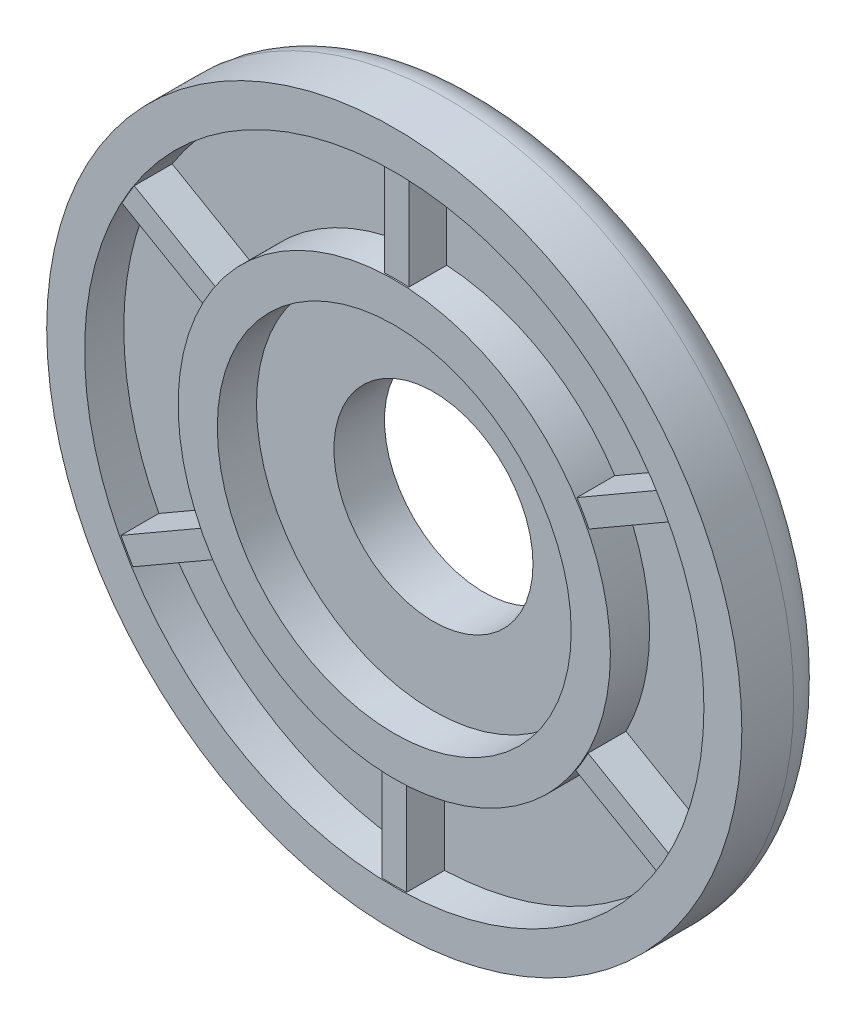
from build123d import *

# Parameters (mm, degrees)
SKETCH_1_R           = 27.5
SKETCH_1_R_2         = 7.875
EXTRUDE_1_DEPTH      = 4
EXTRUDE_2_DEPTH      = 3.1
EXTRUDE_2_DEPTH_BACK = 3.1
SKETCH_2_R           = 27.5
SKETCH_2_R_2         = 24.5
SKETCH_2_R_3         = 17.1
SKETCH_2_R_4         = 14
SKETCH_4_W           = 1.93
SKETCH_4_H           = 8.275236112
EXTRUDE_6_DEPTH      = 3
FILLET_1_R           = 3


with BuildPart() as part:
    # Эскиз1 → Бобышка-Вытянуть1 (new body)
    with BuildSketch(Plane.XY):
        Circle(SKETCH_1_R)
        Circle(SKETCH_1_R_2, mode=Mode.SUBTRACT)
    extrude(amount=EXTRUDE_1_DEPTH)

    # Эскиз2 → Бобышка-Вытянуть2 (add, two sides: drawn at the far end of the back side and taken through both)
    # profile 1 of 2: a face of its own
    with BuildSketch(Plane.XY.offset(4).offset(-EXTRUDE_2_DEPTH_BACK)):
        Circle(SKETCH_2_R)
        Circle(SKETCH_2_R_2, mode=Mode.SUBTRACT)
    # profile 2 of 2: a face of its own
    with BuildSketch(Plane.XY.offset(4).offset(-EXTRUDE_2_DEPTH_BACK)):
        Circle(SKETCH_2_R_3)
        Circle(SKETCH_2_R_4, mode=Mode.SUBTRACT)
    extrude(amount=EXTRUDE_2_DEPTH + EXTRUDE_2_DEPTH_BACK)

    # Эскиз4 → Бобышка-Вытянуть6 (add)
    with BuildSketch(Plane.XY.offset(4)):
        with Locations((0.086458379, 20.793066493)):
            Rectangle(SKETCH_4_W, SKETCH_4_H)
        Polygon((22.116335342, 11.554752607), (21.151335342, 13.226181637), (13.984770647, 9.088563581), (14.949770647, 7.417134552), align=None)
        Polygon((21.064876963, -13.375931941), (22.029876963, -11.704502912), (14.863312269, -7.566884856), (13.898312269, -9.238313886), align=None)
        with Locations((-0.086458379, -20.793066493)):
            Rectangle(SKETCH_4_W, SKETCH_4_H)
        Polygon((-22.116335342, -11.554752607), (-21.151335342, -13.226181637), (-13.984770647, -9.088563581), (-14.949770647, -7.417134552), align=None)
        Polygon((-21.064876963, 13.375931941), (-22.029876963, 11.704502912), (-14.863312269, 7.566884856), (-13.898312269, 9.238313886), align=None)
    extrude(amount=EXTRUDE_6_DEPTH)

    # Скругление1
    fillet_1_edges = [part.edges().sort_by_distance(p)[0] for p in [
        (-27.5, 0, 0),
    ]]
    fillet(fillet_1_edges, radius=FILLET_1_R)


solid = part.part
